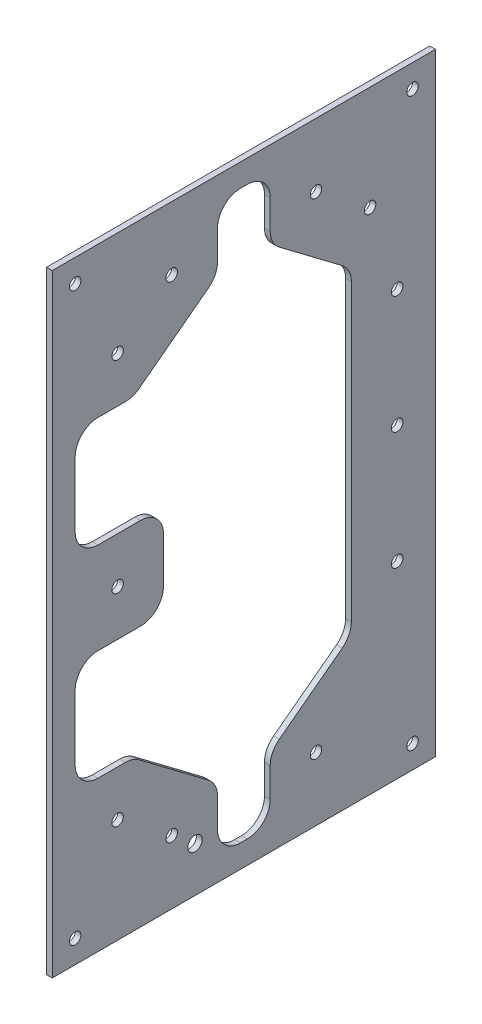
from build123d import *

# Parameters (mm, degrees)
SKETCH1_W           = 212.5
SKETCH1_H           = 339.725
SKETCH1_R           = 3.175
BOSS_EXTRUDE1_DEPTH = 3.175
CUT_EXTRUDE1_DEPTH  = 401.72360331
CUT_EXTRUDE2_DEPTH  = 13.97


with BuildPart() as part:
    # Sketch1 → Boss-Extrude1 (new body)
    with BuildSketch(Plane(origin=(0, 0, 0), x_dir=(0, 0, -1), z_dir=(1, 0, 0))):
        with Locations((106.25, -169.8625)):
            Rectangle(SKETCH1_W, SKETCH1_H)
        with Locations((12.7, -12.7)):
            Circle(SKETCH1_R, mode=Mode.SUBTRACT)
        with Locations((199.8, -12.7)):
            Circle(SKETCH1_R, mode=Mode.SUBTRACT)
        with Locations((66.25, -35.2425)):
            Circle(SKETCH1_R, mode=Mode.SUBTRACT)
        with Locations((146.25, -35.2425)):
            Circle(SKETCH1_R, mode=Mode.SUBTRACT)
        with Locations((176.25, -57.8625)):
            Circle(SKETCH1_R, mode=Mode.SUBTRACT)
        with Locations((36.25, -57.8625)):
            Circle(SKETCH1_R, mode=Mode.SUBTRACT)
        with Locations((191.25, -104.5325)):
            Circle(SKETCH1_R, mode=Mode.SUBTRACT)
        with Locations((36.25, -169.8625)):
            Circle(SKETCH1_R, mode=Mode.SUBTRACT)
        with Locations((191.25, -169.8625)):
            Circle(SKETCH1_R, mode=Mode.SUBTRACT)
        with Locations((36.25, -281.8625)):
            Circle(SKETCH1_R, mode=Mode.SUBTRACT)
        with Locations((66.25, -304.4825)):
            Circle(SKETCH1_R, mode=Mode.SUBTRACT)
        with Locations((12.7, -327.025)):
            Circle(SKETCH1_R, mode=Mode.SUBTRACT)
        with Locations((199.8, -327.025)):
            Circle(SKETCH1_R, mode=Mode.SUBTRACT)
        with Locations((146.25, -304.4825)):
            Circle(SKETCH1_R, mode=Mode.SUBTRACT)
        with Locations((191.25, -235.1925)):
            Circle(SKETCH1_R, mode=Mode.SUBTRACT)
    extrude(amount=BOSS_EXTRUDE1_DEPTH)

    # Sketch2 → Cut-Extrude1 (cut, through all)
    with BuildSketch(Plane(origin=(3.175, 0, 0), x_dir=(0, 0, -1), z_dir=(1, 0, 0))):
        with BuildLine():
            Line((165.85, -251.563304242), (165.85, -88.161695758))
            ThreePointArc((165.85, -88.161695758), (164.516472011, -82.49659964), (160.795934799, -78.021198677))
            Line((160.795934799, -78.021198677), (125.904065201, -51.712729))
            ThreePointArc((125.904065201, -51.712729), (122.183527989, -47.237328037), (120.85, -41.572231919))
            Line((120.85, -41.572231919), (120.85, -25.4))
            ThreePointArc((120.85, -25.4), (117.130256121, -16.419743879), (108.15, -12.7))
            Line((108.15, -12.7), (104.35, -12.7))
            ThreePointArc((104.35, -12.7), (95.369743879, -16.419743879), (91.65, -25.4))
            Line((91.65, -25.4), (91.65, -41.572231919))
            ThreePointArc((91.65, -41.572231919), (90.316472011, -47.237328037), (86.595934799, -51.712729))
            Line((86.595934799, -51.712729), (61.65, -70.521963839))
            Line((61.65, -70.521963839), (48.147303392, -80.702997081))
            ThreePointArc((48.147303392, -80.702997081), (44.532850149, -82.605637318), (40.501368593, -83.2625))
            Line((40.501368593, -83.2625), (25.4, -83.2625))
            ThreePointArc((25.4, -83.2625), (16.419743879, -86.982243879), (12.7, -95.9625))
            Line((12.7, -95.9625), (12.7, -131.7625))
            ThreePointArc((12.7, -131.7625), (16.419743879, -140.742756121), (25.4, -144.4625))
            Line((25.4, -144.4625), (48.95, -144.4625))
            ThreePointArc((48.95, -144.4625), (57.930256121, -148.182243879), (61.65, -157.1625))
            Line((61.65, -157.1625), (61.65, -182.5625))
            ThreePointArc((61.65, -182.5625), (57.930256121, -191.542756121), (48.95, -195.2625))
            Line((48.95, -195.2625), (25.4, -195.2625))
            ThreePointArc((25.4, -195.2625), (16.419743879, -198.982243879), (12.7, -207.9625))
            Line((12.7, -207.9625), (12.7, -243.7625))
            ThreePointArc((12.7, -243.7625), (16.419743879, -252.742756121), (25.4, -256.4625))
            Line((25.4, -256.4625), (40.501368593, -256.4625))
            ThreePointArc((40.501368593, -256.4625), (44.532850149, -257.119362682), (48.147303392, -259.022002919))
            Line((48.147303392, -259.022002919), (61.65, -269.203036161))
            Line((61.65, -269.203036161), (86.595934799, -288.012271))
            ThreePointArc((86.595934799, -288.012271), (90.316472011, -292.487671963), (91.65, -298.152768081))
            Line((91.65, -298.152768081), (91.65, -314.325))
            ThreePointArc((91.65, -314.325), (95.369743879, -323.305256121), (104.35, -327.025))
            Line((104.35, -327.025), (108.15, -327.025))
            ThreePointArc((108.15, -327.025), (117.130256121, -323.305256121), (120.85, -314.325))
            Line((120.85, -314.325), (120.85, -298.152768081))
            ThreePointArc((120.85, -298.152768081), (122.183527989, -292.487671963), (125.904065201, -288.012271))
            Line((125.904065201, -288.012271), (160.795934799, -261.703801323))
            ThreePointArc((160.795934799, -261.703801323), (164.516472011, -257.22840036), (165.85, -251.563304242))
        make_face()
    extrude(amount=-CUT_EXTRUDE1_DEPTH, mode=Mode.SUBTRACT)

    # Sketch3 → Cut-Extrude2 (cut)
    with BuildSketch(Plane.ZY):
        with BuildLine():
            ThreePointArc((-79.15, -318.725), (-76.321572875, -317.553427125), (-75.15, -314.725))
            ThreePointArc((-75.15, -314.725), (-81.978427125, -311.896572875), (-79.15, -318.725))
        make_face()
    extrude(amount=-CUT_EXTRUDE2_DEPTH, mode=Mode.SUBTRACT)


solid = part.part
